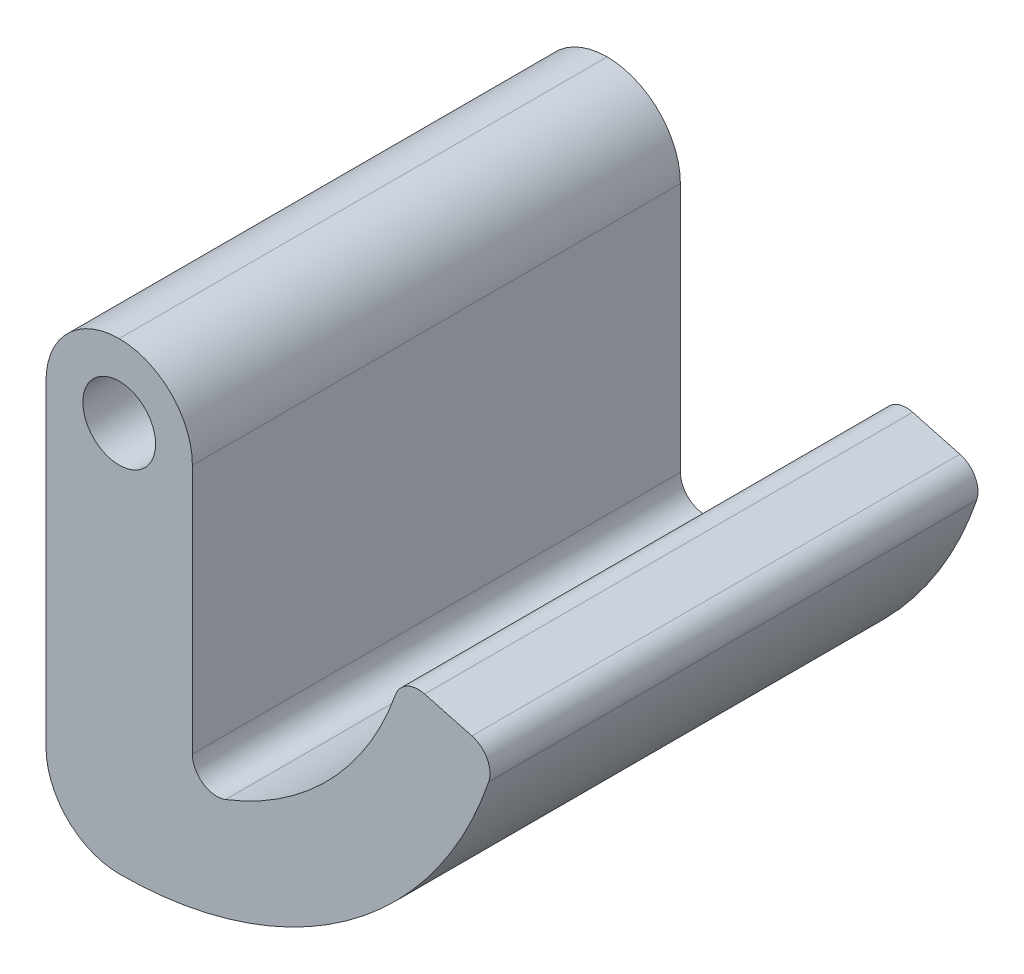
from build123d import *

# Parameters (mm, degrees)
SKETCH2_R           = 2.98
BOSS_EXTRUDE1_DEPTH = 20
FILLET1_R           = 6
FILLET2_R           = 2


with BuildPart() as part:
    # Sketch2 → Boss-Extrude1 (new, symmetric)
    with BuildSketch(Plane.XY):
        with BuildLine():
            Line((-6, 6), (6, 6))
            Line((6, 6), (6, -23.237900077))
            ThreePointArc((6, -23.237900077), (16.893008204, -17.047764481), (23.182219831, -6.211657082))
            Line((23.182219831, -6.211657082), (30.909626441, -8.282209443))
            ThreePointArc((30.909626441, -8.282209443), (19.480365728, -25.387306889), (0, -32))
            Line((0, -32), (-6, -32))
            Line((-6, -32), (-6, 6))
        make_face()
        Circle(SKETCH2_R, mode=Mode.SUBTRACT)
    extrude(amount=BOSS_EXTRUDE1_DEPTH, both=True)

    # Fillet1
    fillet1_edges = [part.edges().sort_by_distance(p)[0] for p in [
        (6, 6, 0),
        (-6, 6, 0),
        (-6, -32, 0),
    ]]
    fillet(fillet1_edges, radius=FILLET1_R - 0.0001)  # a hair under: the kernel refuses the full size

    # Fillet2
    fillet2_edges = [part.edges().sort_by_distance(p)[0] for p in [
        (6, -23.237900077, 0),
        (23.182219831, -6.211657082, 0),
        (30.909626441, -8.282209443, 0),
    ]]
    fillet(fillet2_edges, radius=FILLET2_R)


solid = part.part
